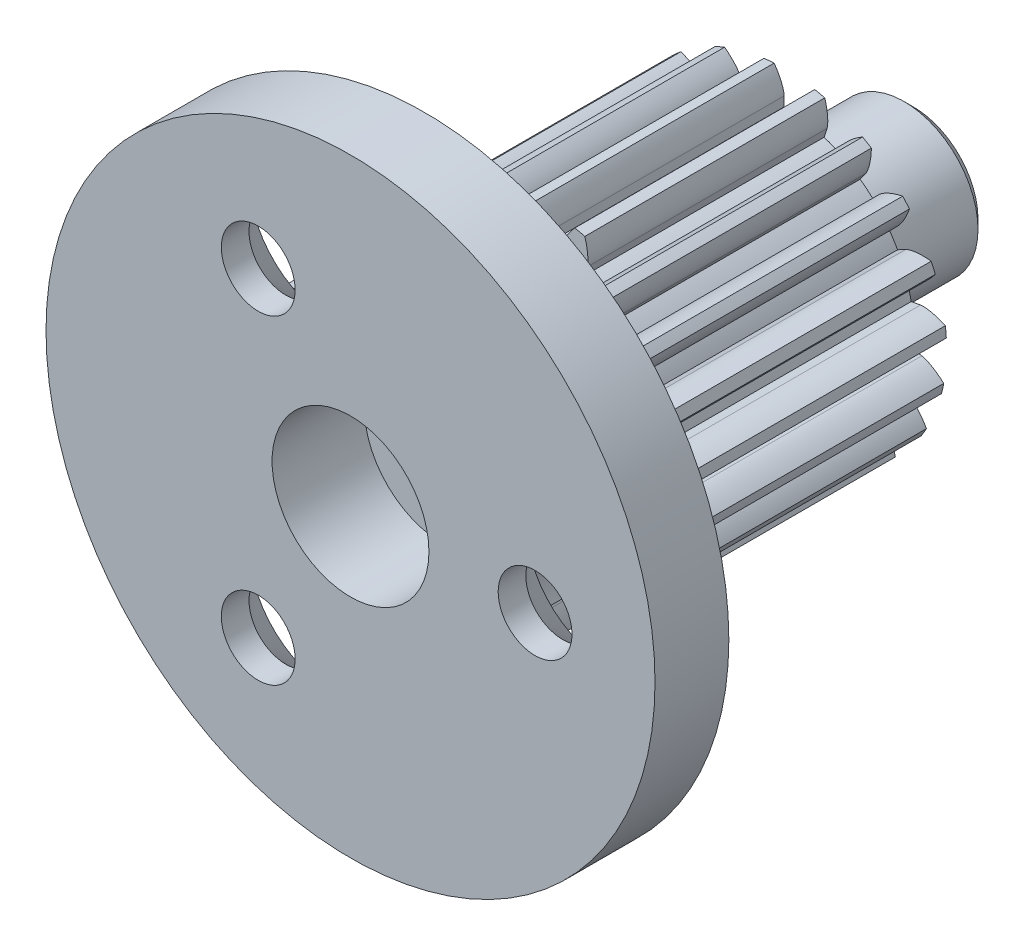
from build123d import *

# Parameters (mm, degrees)
SKETCH1_R           = 8.8
BOSS_EXTRUDE1_DEPTH = 9.75
CUT_EXTRUDE1_DEPTH  = 16.80956988662247
CIRPATTERN2_COUNT   = 20
CHAMFER1_SIZE       = 0.5
CHAMFER2_SIZE       = 0.5
SKETCH4_R           = 2.5
CUT_EXTRUDE2_DEPTH  = 39.402473964576814
SKETCH5_R           = 4.25
CUT_EXTRUDE3_DEPTH  = 5
SKETCH6_R           = 2.0000000000000004
SKETCH6_R_2         = 1.9999999999999996
CUT_EXTRUDE4_DEPTH  = 36.309347297847346
CIRPATTERN3_COUNT   = 3
SKETCH8_R           = 4.5
SKETCH8_R_2         = 4.500000000000002
CUT_EXTRUDE5_DEPTH  = 6.5


with BuildPart() as part:
    # Sketch1 → Boss-Extrude1 (new, symmetric)
    with BuildSketch(Plane.XY):
        Circle(SKETCH1_R)
    extrude(amount=BOSS_EXTRUDE1_DEPTH, both=True)

    # Sketch2 → Cut-Extrude1 (cut, symmetric)
    with BuildSketch(Plane.XY):
        with BuildLine():
            add(Edge.make_bspline(
                [(7.517540966287267, 0), (7.520110866708064, 3.697278411484e-05), (7.527316988044233, 0.00025516849437089), (7.549556806339448, 0.00166762296979139), (7.593331739402326, 0.00653119652503209), (7.647158847839554, 0.01551170924606528), (7.708756635261055, 0.02867101269465142), (7.767907562216142, 0.04359454677791173), (7.818276462045496, 0.05772874611177531), (7.868310581554778, 0.07310327790415132), (7.917948492159066, 0.0895660424849033), (7.977812878871355, 0.1108577462916486), (8.049216207682885, 0.13826222948881114), (8.132064495868066, 0.1730061699499254), (8.225261451631324, 0.21559950195461527), (8.31934687768635, 0.26238914275803843), (8.411162907448706, 0.31119897040108835), (8.502976334983792, 0.3636652458286479), (8.59112899541961, 0.4166600780142432), (8.674672150948917, 0.47041627730737856), (8.731059450555389, 0.5078888913036268), (8.767993640518084, 0.533390395266864), (8.783169443024494, 0.5439986536029677)],
                knots=[0, 0, 0, 0, 0, 0.00537674862614496, 0.01508368816988055, 0.04661013955240243, 0.09211052548719963, 0.11947617586779116, 0.14684249576846414, 0.1742088538870799, 0.201574955629501, 0.22894101319225185, 0.2563073451901878, 0.3070350321649608, 0.3617673517707386, 0.41649966071787375, 0.4712319366918095, 0.5259642819310837, 0.5806966155459512, 0.6354289822487561, 0.6901613872332595, 0.7280749968168504, 0.7280749968168504, 0.7280749968168504, 0.7280749968168504, 0.7280749968168504], degree=4))
            Line((7.517540966287267, 0), (7, 0))
            ThreePointArc((7, -1.71e-15), (6.985831643229987, -0.44514745023039903), (6.943383927872393, -0.8884928982064746))
            Line((6.943383927872394, -0.8884928982064723), (7.456739017491617, -0.9541831086460635))
            add(Edge.make_bspline(
                [(7.4567390174916195, -0.9541831086460634), (7.459283439666169, -0.9545459735757729), (7.466403582770318, -0.9556770598927099), (7.488284245790196, -0.9599009362235743), (7.531087805234263, -0.9702814184523688), (7.583339684924586, -0.9860214400621533), (7.642768990569706, -1.0068927675959174), (7.699547296496782, -1.0292034826277108), (7.747714792755213, -1.0496165658101342), (7.795392784031863, -1.071217456781249), (7.842539644215671, -1.093847489074389), (7.899217343205462, -1.1225654257112856), (7.966564777057653, -1.1588113112455627), (8.044333023955163, -1.2037899731698565), (8.131369934208747, -1.2578680717706654), (8.21875550157375, -1.316221310745009), (8.303633610166434, -1.3762903483398619), (8.388045033594626, -1.4399859300376183), (8.46875820982767, -1.5037411412965747), (8.544802524410278, -1.5676664885218703), (8.59597745561188, -1.6119931258084506), (8.629376077870585, -1.6419763398423912), (8.643082658016503, -1.6544250260116742)],
                knots=[0, 0, 0, 0, 0, 0.00537674862614445, 0.01508368816988041, 0.04661013955240261, 0.09211052548719989, 0.1194761758677911, 0.1468424957684644, 0.1742088538870796, 0.2015749556295012, 0.2289410131922521, 0.25630734519018794, 0.30703503216495975, 0.3617673517707386, 0.4164996607178728, 0.4712319366918089, 0.5259642819310841, 0.5806966155459516, 0.6354289822487563, 0.6901613872332594, 0.7280749968167778, 0.7280749968167778, 0.7280749968167778, 0.7280749968167778, 0.7280749968167778], degree=4))
            ThreePointArc((8.643082658016542, -1.6544250260116664), (8.76068283270618, -0.8309249693728202), (8.8, -2.16e-15))
            ThreePointArc((8.8, 0), (8.795791354352803, 0.272129474134082), (8.783169443024434, 0.5439986536029847))
        make_face()
    cut_extrude1 = extrude(amount=CUT_EXTRUDE1_DEPTH, both=True, mode=Mode.SUBTRACT)

    # CirPattern2: Cut-Extrude1 ×20 about axis
    cirpattern2_axis = Axis((0, 0, -9.75), (0, 0, 1))
    for i in range(1, CIRPATTERN2_COUNT):
        add(cut_extrude1.rotate(cirpattern2_axis, i * 360 / CIRPATTERN2_COUNT), mode=Mode.SUBTRACT)

    # Sketch3 → Revolve1 (revolve)
    with BuildSketch(Plane(origin=(0, 0, 0), x_dir=(1, 0, 0), z_dir=(0, 1, 0))):
        Polygon((1.19e-15, 9.75), (0, 16.749999999999993), (-4, 16.749999999999993), (-3.9999999999999982, 11.249999999999996), (-4.499999999999999, 11.249999999999996), (-4.499999999999999, 9.75), align=None)
        Polygon((5.2e-15, -13.75), (4.52e-15, -9.75), (-16.499999999999996, -9.750000000000002), (-16.499999999999993, -13.750000000000002), align=None)
    revolve(axis=Axis((1.36e-15, 0, -9.75), (-1.2e-16, 0, -1)))

    # Chamfer1
    chamfer1_edges = [part.edges().sort_by_distance(p)[0] for p in [
        (4.500000000000003, 5.5e-16, -9.75),
    ]]
    chamfer(chamfer1_edges, length=CHAMFER1_SIZE)

    # Chamfer2
    chamfer2_edges = [part.edges().sort_by_distance(p)[0] for p in [
        (4.000000000000002, 4.9e-16, -16.749999999999993),
    ]]
    chamfer(chamfer2_edges, length=CHAMFER2_SIZE)

    # Sketch4 → Cut-Extrude2 (cut, through all)
    with BuildSketch(Plane.XY.offset(13.75)):
        Circle(SKETCH4_R)
    extrude(amount=-CUT_EXTRUDE2_DEPTH, mode=Mode.SUBTRACT)

    # Sketch5 → Cut-Extrude3 (cut)
    with BuildSketch(Plane.XY.offset(13.75)):
        Circle(SKETCH5_R)
    extrude(amount=-CUT_EXTRUDE3_DEPTH, mode=Mode.SUBTRACT)

    # Sketch6 → Cut-Extrude4 (cut, through all)
    with BuildSketch(Plane(origin=(1.2e-15, 0, 9.75), x_dir=(-1, 0, -1.65e-15), z_dir=(1.65e-15, 0, -1))):
        with Locations((5.000000000000021, 8.660254037844387)):
            Circle(SKETCH6_R)
        with Locations((5.000000000000017, -8.660254037844389)):
            Circle(SKETCH6_R)
        with Locations((-9.999999999999982, -1.22e-15)):
            Circle(SKETCH6_R_2)
    extrude(amount=-CUT_EXTRUDE4_DEPTH, mode=Mode.SUBTRACT)

    # Sketch7 → Cut-Revolve1 (revolve, cut)
    with BuildSketch(Plane(origin=(0, 0, 0), x_dir=(1, 0, 0), z_dir=(0, 1, 0))):
        Polygon((11.999999999999984, -9.749999999999998), (9.999999999999977, -9.749999999999998), (9.999999999999977, -12.249999999999998), (11.999999999999977, -12.249999999999998), (14.499999999999979, -9.75), align=None)
    cut_revolve1 = revolve(axis=Axis((9.999999999999977, 0, 9.749999999999998), (0, 0, 1)), mode=Mode.SUBTRACT)

    # CirPattern3: Cut-Revolve1 ×3 about axis
    cirpattern3_axis = Axis((1.511e-14, 0, -16.749999999999993), (0, 0, 1))
    for i in range(1, CIRPATTERN3_COUNT):
        add(cut_revolve1.rotate(cirpattern3_axis, i * 360 / CIRPATTERN3_COUNT), mode=Mode.SUBTRACT)

    # Sketch8 → Cut-Extrude5 (cut)
    with BuildSketch(Plane(origin=(1.2e-15, 0, 9.75), x_dir=(-1, 0, 1.2e-16), z_dir=(-1.2e-16, 0, -1))):
        with Locations((1.8e-16, 10)):
            Circle(SKETCH8_R)
        with Locations((8.660254037844362, -5.000000000000015)):
            Circle(SKETCH8_R_2)
        with Locations((-8.66025403784441, -4.9999999999999885)):
            Circle(SKETCH8_R)
    extrude(amount=CUT_EXTRUDE5_DEPTH, mode=Mode.SUBTRACT)


solid = part.part
